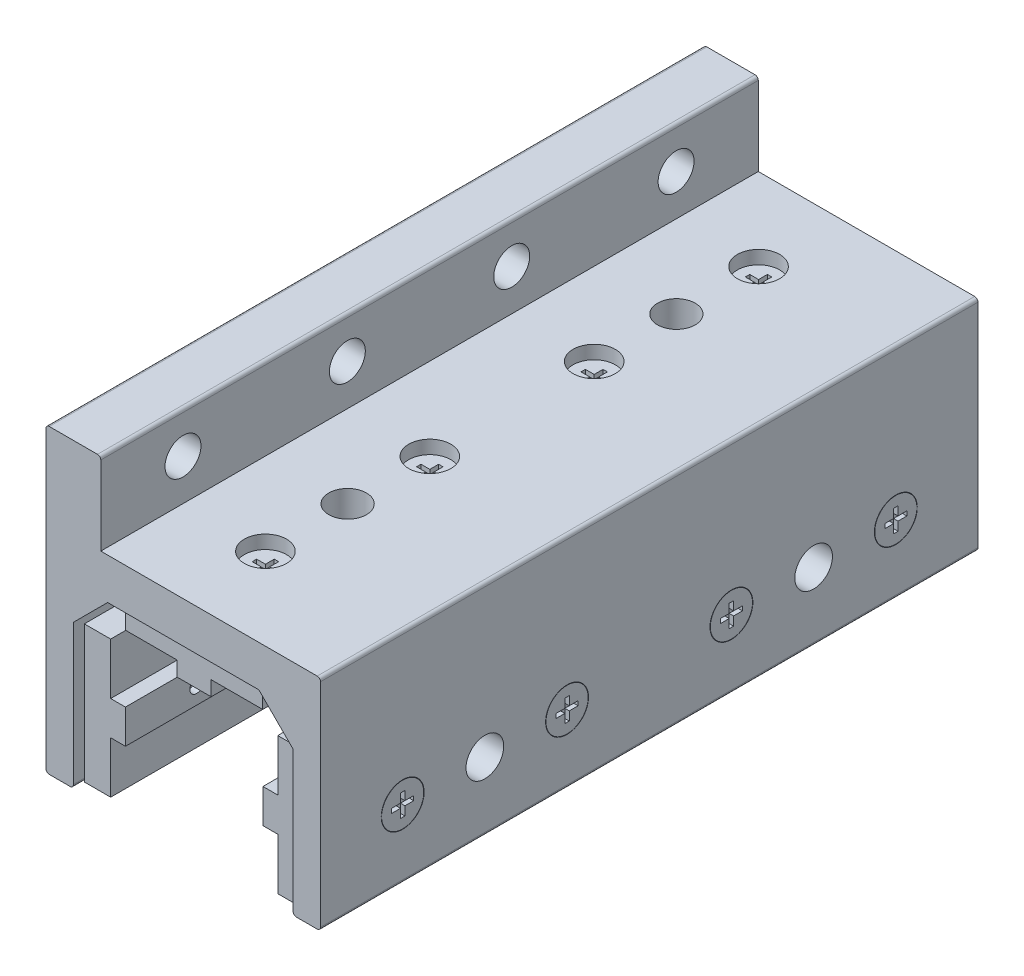
from build123d import *

# Parameters (mm, degrees)
BOSS_EXTRUDE1_DEPTH     = 76.2
BOSS_EXTRUDE2_START     = 2.54
BOSS_EXTRUDE2_DEPTH     = 71.12
CUT_EXTRUDE1_DEPTH      = 90.656535775
CUT_EXTRUDE1_DEPTH_BACK = 90.656535775
SKETCH6_R               = 2.5527
SKETCH6_R_2             = 4.3688
SKETCH6_R_3             = 4.1656
SKETCH7_R               = 1.5875
SKETCH7_W               = 8.7376
SKETCH7_H               = 8.7376
CUT_EXTRUDE2_DEPTH      = 90.656535775
SKETCH8_R               = 2.5527
CUT_EXTRUDE3_DEPTH      = 9.525
SKETCH9_R               = 4.8895
CUT_EXTRUDE4_DEPTH      = 3.175
CHAMFER1_SIZE           = 2.4216433
CHAMFER1_SIZE_2         = 2.032
CUT_EXTRUDE5_DEPTH      = 1.039015
LPATTERN1_COUNT         = 2
LPATTERN1_PITCH         = 38.1
CIRPATTERN1_COUNT       = 3
CIRPATTERN1_ANGLE       = 180
FILLET1_R               = 0.762
SKETCH14_R              = 4.3688
CUT_EXTRUDE6_DEPTH      = 97.949361949


with BuildPart() as part:
    # Sketch4 → Boss-Extrude1 (new body)
    with BuildSketch(Plane.XY):
        Polygon((-31.8135, -34.925), (-25.4635, -34.925), (-25.4635, -1.5875), (-17.526, 6.35), (17.526, 6.35), (25.4635, -1.5875), (25.4635, -34.925), (31.8135, -34.925), (31.8135, 15.875), (-19.1135, 15.875), (-19.1135, 34.925), (-31.8135, 34.925), align=None)
    extrude(amount=BOSS_EXTRUDE1_DEPTH)

    # Sketch6 → Cut-Extrude1 (cut, two sides: drawn at the far end of the back side and taken through both)
    with BuildSketch(Plane(origin=(0, 0, 0), x_dir=(0, 0, -1), z_dir=(1, 0, 0)).offset(-CUT_EXTRUDE1_DEPTH_BACK)):
        with Locations((-57.15, -19.05)):
            Circle(SKETCH6_R)
        with Locations((-38.1, -19.05)):
            Circle(SKETCH6_R_2)
        with Locations((-19.05, -19.05)):
            Circle(SKETCH6_R)
        with Locations((-19.05, 25.4)):
            Circle(SKETCH6_R_3)
        with Locations((-57.15, 25.4)):
            Circle(SKETCH6_R_3)
    extrude(amount=CUT_EXTRUDE1_DEPTH + CUT_EXTRUDE1_DEPTH_BACK, mode=Mode.SUBTRACT)

    # Sketch8 → Cut-Extrude3 (cut)
    with BuildSketch(Plane(origin=(0, 15.875, 0), x_dir=(1, 0, 0), z_dir=(0, 1, 0))):
        with Locations(Location((0, -19.05, 0), (0, 0, 180))):
            Circle(SKETCH8_R)
        with Locations(Location((0, -57.15, 0), (0, 0, 180))):
            Circle(SKETCH8_R)
    extrude(amount=-CUT_EXTRUDE3_DEPTH, mode=Mode.SUBTRACT)

    # Sketch9 → Cut-Extrude4 (cut)
    with BuildSketch(Plane(origin=(0, 15.875, 0), x_dir=(1, 0, 0), z_dir=(0, 1, 0))):
        with Locations(Location((0, -19.05, 0), (0, 0, 180))):
            Circle(SKETCH9_R)
        with Locations(Location((0, -57.15, 0), (0, 0, 180))):
            Circle(SKETCH9_R)
    extrude(amount=-CUT_EXTRUDE4_DEPTH, mode=Mode.SUBTRACT)

    # Chamfer1
    # the kernel refuses this chamfer: 2.4216433, 2.032 mm, written as the material it takes off along each edge
    with BuildSketch(Plane(origin=(-31.8135, -19.05, 19.05), x_dir=(0, 0, -1), z_dir=(0, -1, 0))) as chamfer1_piece_1:
        Polygon((2.5527 + CHAMFER1_SIZE, 0), (2.5527, CHAMFER1_SIZE_2), (2.5527, 0), align=None)
    revolve(axis=Axis((-31.8135, -19.05, 19.05), (1, 0, 0)), mode=Mode.SUBTRACT)
    with BuildSketch(Plane(origin=(-31.8135, -19.05, 57.15), x_dir=(0, 0, -1), z_dir=(0, -1, 0))) as chamfer1_piece_2:
        Polygon((2.5527 + CHAMFER1_SIZE, 0), (2.5527, CHAMFER1_SIZE_2), (2.5527, 0), align=None)
    revolve(axis=Axis((-31.8135, -19.05, 57.15), (1, 0, 0)), mode=Mode.SUBTRACT)
    with BuildSketch(Plane(origin=(31.8135, -19.05, 19.05), x_dir=(0, 0, -1), z_dir=(0, 1, 0))) as chamfer1_piece_3:
        Polygon((2.5527 + CHAMFER1_SIZE, 0), (2.5527, CHAMFER1_SIZE_2), (2.5527, 0), align=None)
    revolve(axis=Axis((31.8135, -19.05, 19.05), (-1, 0, 0)), mode=Mode.SUBTRACT)
    with BuildSketch(Plane(origin=(31.8135, -19.05, 57.15), x_dir=(0, 0, -1), z_dir=(0, 1, 0))) as chamfer1_piece_4:
        Polygon((2.5527 + CHAMFER1_SIZE, 0), (2.5527, CHAMFER1_SIZE_2), (2.5527, 0), align=None)
    revolve(axis=Axis((31.8135, -19.05, 57.15), (-1, 0, 0)), mode=Mode.SUBTRACT)
    with BuildSketch(Plane(origin=(0, 12.7, 57.15), x_dir=(-1, 0, 0), z_dir=(0, 0, -1))) as chamfer1_piece_5_section:
        Polygon((2.5527, -CHAMFER1_SIZE_2), (2.5527 + CHAMFER1_SIZE, 0), (2.5527, 0), align=None)
    chamfer1_piece_5 = revolve(axis=Axis((0, 12.7, 57.15), (0, 1, 0)), mode=Mode.PRIVATE)
    chamfer1_piece_5 = chamfer1_piece_5 & Plane(origin=(0, 11.646758484, 57.15), x_dir=(-1, 0, 0), z_dir=(0, 1, 0)) * Cylinder(4.8895, 20, mode=Mode.PRIVATE)
    add(chamfer1_piece_5, mode=Mode.SUBTRACT)
    with BuildSketch(Plane(origin=(0, 12.7, 19.05), x_dir=(-1, 0, 0), z_dir=(0, 0, -1))) as chamfer1_piece_6_section:
        Polygon((2.5527, -CHAMFER1_SIZE_2), (2.5527 + CHAMFER1_SIZE, 0), (2.5527, 0), align=None)
    chamfer1_piece_6 = revolve(axis=Axis((0, 12.7, 19.05), (0, 1, 0)), mode=Mode.PRIVATE)
    chamfer1_piece_6 = chamfer1_piece_6 & Plane(origin=(0, 11.646758484, 19.05), x_dir=(-1, 0, 0), z_dir=(0, 1, 0)) * Cylinder(4.8895, 20, mode=Mode.PRIVATE)
    add(chamfer1_piece_6, mode=Mode.SUBTRACT)

    # Fillet1
    fillet1_edges = [part.edges().sort_by_distance(p)[0] for p in [
        (-31.8135, 34.925, 38.1),
        (-19.1135, 34.925, 38.1),
        (31.8135, 15.875, 38.1),
        (31.8135, -34.925, 38.1),
        (25.4635, -34.925, 38.1),
        (-25.4635, -34.925, 38.1),
        (-31.8135, -34.925, 38.1),
    ]]
    fillet(fillet1_edges, radius=FILLET1_R)

    # Sketch14 → Cut-Extrude6 (cut, through all)
    with BuildSketch(Plane(origin=(0, 15.875, 0), x_dir=(1, 0, 0), z_dir=(0, 1, 0))):
        with Locations(Location((0, -38.1, 0), (0, 0, 180))):
            Circle(SKETCH14_R)
    extrude(amount=-CUT_EXTRUDE6_DEPTH, mode=Mode.SUBTRACT)


with BuildPart() as body_2:
    # Sketch5 → Boss-Extrude2 (new body)
    with BuildSketch(Plane.XY.offset(BOSS_EXTRUDE2_START)):
        Polygon((-25.4635, -3.175), (-25.4635, -34.925), (-19.3675, -34.925), (-19.3675, -22.987), (-15.9385, -22.987), (-15.9385, -15.113), (-19.3675, -15.113), (-19.3675, -3.175), align=None)
    extrude(amount=BOSS_EXTRUDE2_DEPTH)

    # Sketch7 → Cut-Extrude2 (cut, through all)
    with BuildSketch(Plane(origin=(0, 0, 0), x_dir=(0, 0, -1), z_dir=(1, 0, 0))):
        with Locations((-57.15, -19.05)):
            Circle(SKETCH7_R)
        with Locations((-19.05, -19.05)):
            Circle(SKETCH7_R)
        with Locations((-38.1, -19.05)):
            Rectangle(SKETCH7_W, SKETCH7_H)
    extrude(amount=-CUT_EXTRUDE2_DEPTH, mode=Mode.SUBTRACT)


with BuildPart() as body_3:
    # Sketch12 → Revolve1 (revolve)
    with BuildSketch(Plane.XY.offset(57.15), mode=Mode.PRIVATE) as revolve1_sk:
        Polygon((-31.8135, -14.1605), (-31.8135, -19.05), (-17.653, -19.05), (-17.653, -16.637), (-29.735469763, -16.637), align=None)
    revolve(revolve1_sk.sketch.rotate(Axis((-31.8135, -19.05, 57.15), (1, 0, 0)), 90), axis=Axis((-31.8135, -19.05, 57.15), (1, 0, 0)))

    # Sketch13 → Cut-Extrude5 (cut)
    with BuildSketch(Plane.ZY.offset(31.8135)):
        Polygon((57.66054, -21.6027), (56.63946, -21.6027), (56.63946, -19.56054), (54.5973, -19.56054), (54.5973, -18.53946), (56.63946, -18.53946), (56.63946, -16.4973), (57.66054, -16.4973), (57.66054, -18.53946), (59.7027, -18.53946), (59.7027, -19.56054), (57.66054, -19.56054), align=None)
    extrude(amount=-CUT_EXTRUDE5_DEPTH, mode=Mode.SUBTRACT)


with BuildPart() as lpattern1_1:
    # LPattern1: pattern copy
    add(body_3.part.moved(Location(Vector(0, 0, -1) * (1 * LPATTERN1_PITCH))))


with BuildPart() as cirpattern1_1:
    # CirPattern1: pattern copy
    add(body_2.part.rotate(Axis((0, -19.05, 0), (0, 0, -1)), 1 * CIRPATTERN1_ANGLE / (CIRPATTERN1_COUNT - 1)))


with BuildPart() as cirpattern1_2:
    # CirPattern1: pattern copy
    add(body_2.part.rotate(Axis((0, -19.05, 0), (0, 0, -1)), 2 * CIRPATTERN1_ANGLE / (CIRPATTERN1_COUNT - 1)))


with BuildPart() as cirpattern1_3:
    # CirPattern1: pattern copy
    add(body_3.part.rotate(Axis((0, -19.05, 0), (0, 0, -1)), 1 * CIRPATTERN1_ANGLE / (CIRPATTERN1_COUNT - 1)))


with BuildPart() as cirpattern1_4:
    # CirPattern1: pattern copy
    add(body_3.part.rotate(Axis((0, -19.05, 0), (0, 0, -1)), 2 * CIRPATTERN1_ANGLE / (CIRPATTERN1_COUNT - 1)))


with BuildPart() as cirpattern1_5:
    # CirPattern1: pattern copy
    add(lpattern1_1.part.rotate(Axis((0, -19.05, 0), (0, 0, -1)), 1 * CIRPATTERN1_ANGLE / (CIRPATTERN1_COUNT - 1)))


with BuildPart() as cirpattern1_6:
    # CirPattern1: pattern copy
    add(lpattern1_1.part.rotate(Axis((0, -19.05, 0), (0, 0, -1)), 2 * CIRPATTERN1_ANGLE / (CIRPATTERN1_COUNT - 1)))


with BuildPart() as body_11:
    # Mirror1: mirrored copy
    add(part.part.mirror(Plane.XY))


with BuildPart() as body_12:
    # Mirror1 2: mirrored copy
    add(body_2.part.mirror(Plane.XY))


with BuildPart() as body_13:
    # Mirror1 3: mirrored copy
    add(cirpattern1_1.part.mirror(Plane.XY))


with BuildPart() as body_14:
    # Mirror1 4: mirrored copy
    add(cirpattern1_2.part.mirror(Plane.XY))


with BuildPart() as body_15:
    # Mirror1 5: mirrored copy
    add(cirpattern1_4.part.mirror(Plane.XY))


with BuildPart() as body_16:
    # Mirror1 6: mirrored copy
    add(cirpattern1_6.part.mirror(Plane.XY))


with BuildPart() as body_17:
    # Mirror1 7: mirrored copy
    add(cirpattern1_5.part.mirror(Plane.XY))


with BuildPart() as body_18:
    # Mirror1 8: mirrored copy
    add(cirpattern1_3.part.mirror(Plane.XY))


with BuildPart() as body_19:
    # Mirror1 9: mirrored copy
    add(lpattern1_1.part.mirror(Plane.XY))


with BuildPart() as body_20:
    # Mirror1 10: mirrored copy
    add(body_3.part.mirror(Plane.XY))


with BuildPart() as part_1:
    add(part.part)

    # Combine1: union body 11
    add(body_11.part)


solid = Compound([body_2.part, body_3.part, lpattern1_1.part, cirpattern1_1.part, cirpattern1_2.part, cirpattern1_3.part, cirpattern1_4.part, cirpattern1_5.part, cirpattern1_6.part, body_12.part, body_13.part, body_14.part, body_15.part, body_16.part, body_17.part, body_18.part, body_19.part, body_20.part, part_1.part])
